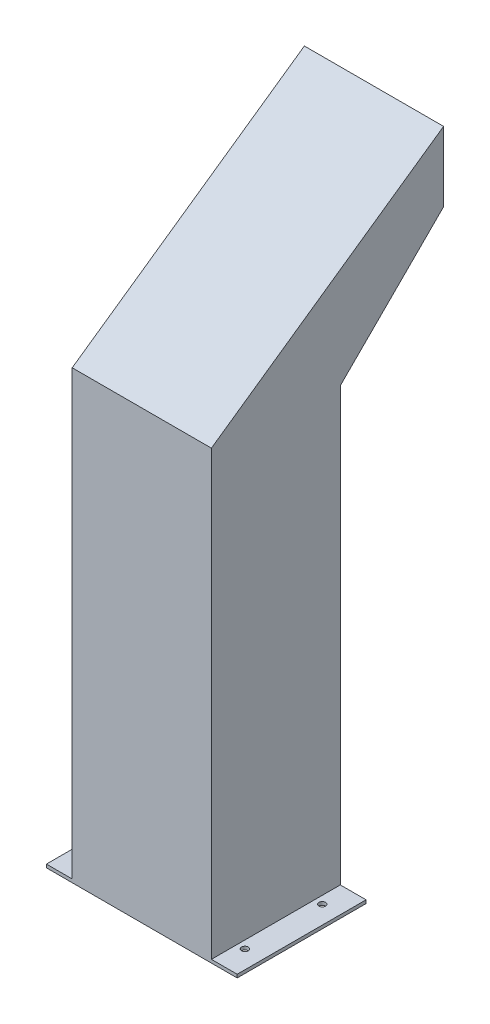
from build123d import *

# Parameters (mm, degrees)
BOSS_EXTRUDE1_DEPTH = 125
SKETCH3_W           = 257.3
SKETCH3_H           = 237.3
CUT_EXTRUDE1_DEPTH  = 1000
BOSS_EXTRUDE2_DEPTH = 135
SHELL1_START        = -125
SHELL1_DEPTH        = 250
SKETCH6_R           = 6.5
CUT_EXTRUDE2_DEPTH  = 30


# Read off the part's stored shape, not the designer's step: Shell1
with BuildPart() as part:
    # Sketch2 → Boss-Extrude1 (new, symmetric)
    with BuildSketch(Plane.XY):
        Polygon((-135, 0), (135, 0), (185, 0), (185, 6.35), (135, 6.35), (135, 845), (-135, 845), (-135, 6.35), (-185, 6.35), (-185, 0), align=None)
    extrude(amount=BOSS_EXTRUDE1_DEPTH, both=True)

    # Sketch3 → Cut-Extrude1 (cut)
    with BuildSketch(Plane(origin=(0, 845, 0), x_dir=(1, 0, 0), z_dir=(0, 1, 0))):
        Rectangle(SKETCH3_W, SKETCH3_H)
    extrude(amount=-CUT_EXTRUDE1_DEPTH, mode=Mode.SUBTRACT)

    # Sketch5 → Boss-Extrude2 (add, symmetric)
    with BuildSketch(Plane(origin=(0, 0, 0), x_dir=(0, 0, -1), z_dir=(1, 0, 0))):
        Polygon((-125, 865), (325.311522824, 1180.311522824), (325.311522824, 1045.311522824), (125, 845), (-125, 845), align=None)
    extrude(amount=BOSS_EXTRUDE2_DEPTH, both=True)

    # Shell1 outline → Shell1 (cut)
    with BuildSketch(Plane.YZ.offset(SHELL1_START)):
        Polygon((855, 115), (855, -120.857864376), (1059.453658448, -325.311522824), (1168.103776937, -325.311522824), (859.794329494, 115), align=None)
    extrude(amount=SHELL1_DEPTH, mode=Mode.SUBTRACT)

    # Sketch6 → Cut-Extrude2 (cut)
    with BuildSketch(Plane.XZ):
        with Locations((150, 75)):
            Circle(SKETCH6_R)
        with Locations(Location((150, -75, 0), (0, 0, 270))):
            Circle(SKETCH6_R)
        with Locations((-150, 75)):
            Circle(SKETCH6_R)
        with Locations((-150, -75)):
            Circle(SKETCH6_R)
    extrude(amount=-CUT_EXTRUDE2_DEPTH, mode=Mode.SUBTRACT)


solid = part.part
